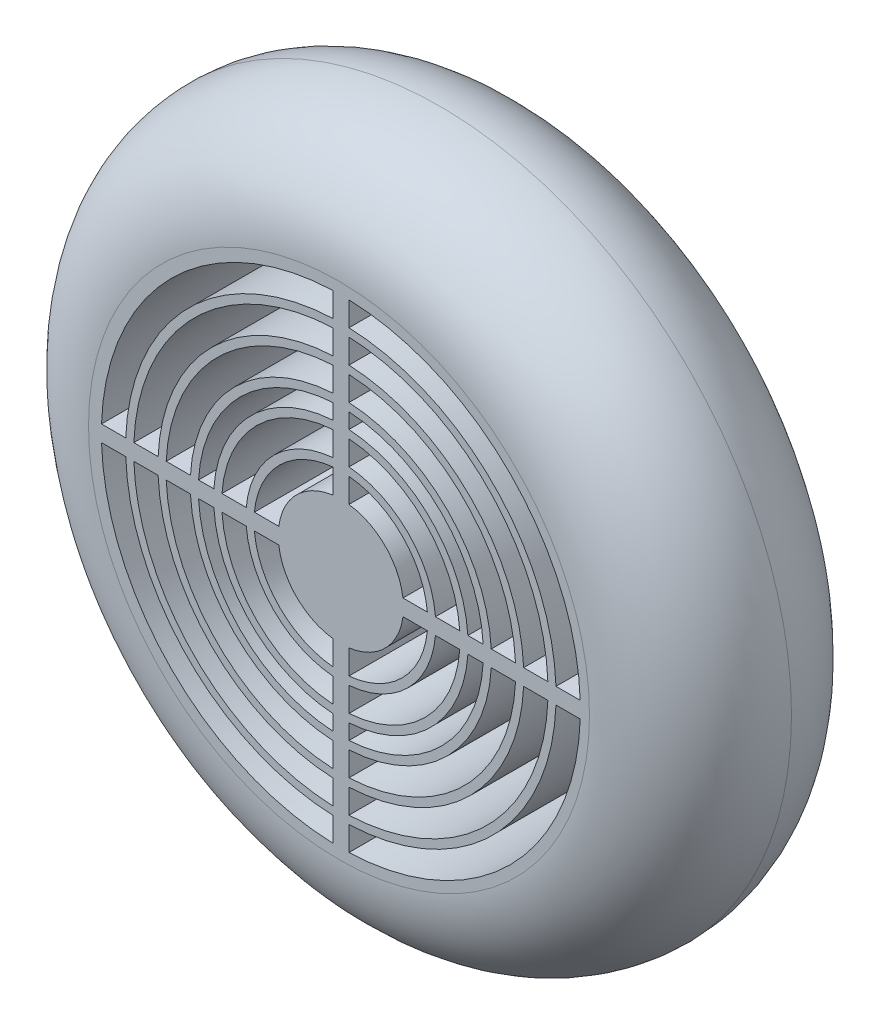
from build123d import *

# Parameters (mm, degrees)
CROQUIS1_R              = 217.5
SALIENTE_EXTRUIR1_DEPTH = 125
REDONDEO2_R             = 62.5
CORTAR_EXTRUIR4_DEPTH   = 115


with BuildPart() as part:
    # Croquis1 → Saliente-Extruir1 (new body)
    with BuildSketch(Plane.XY):
        with Locations((-1.153997035, 0)):
            Circle(CROQUIS1_R)
    extrude(amount=SALIENTE_EXTRUIR1_DEPTH)

    # Redondeo2
    redondeo2_edges = [part.edges().sort_by_distance(p)[0] for p in [
        (-218.653997035, 0, 0),
        (-218.653997035, 0, 125),
    ]]
    fillet(redondeo2_edges, radius=REDONDEO2_R - 0.0001)  # a hair under: the kernel refuses the full size

    # Croquis6 → Cortar-Extruir4 (cut)
    with BuildSketch(Plane.XY.offset(125)):
        with BuildLine():
            ThreePointArc((148.115736426, 5), (104.793299826, 104.793299826), (5, 148.115736426))
            Line((5, 148.115736426), (5, 133.106229009))
            ThreePointArc((5, 133.106229009), (94.186698108, 94.186698108), (133.106229009, 5))
            Line((133.106229009, 5), (148.115736426, 5))
        make_face()
        with BuildLine():
            ThreePointArc((5, -148.115736426), (104.793299826, -104.793299826), (148.115736426, -5))
            Line((148.115736426, -5), (133.106229009, -5))
            ThreePointArc((133.106229009, -5), (94.186698108, -94.186698108), (5, -133.106229009))
            Line((5, -133.106229009), (5, -148.115736426))
        make_face()
        with BuildLine():
            Line((-133.106229009, -5), (-148.115736426, -5))
            ThreePointArc((-148.115736426, -5), (-104.793299826, -104.793299826), (-5, -148.115736426))
            Line((-5, -148.115736426), (-5, -133.106229009))
            ThreePointArc((-5, -133.106229009), (-94.186698108, -94.186698108), (-133.106229009, -5))
        make_face()
        with BuildLine():
            Line((-5, 133.106229009), (-5, 148.115736426))
            ThreePointArc((-5, 148.115736426), (-104.793299826, 104.793299826), (-148.115736426, 5))
            Line((-148.115736426, 5), (-133.106229009, 5))
            ThreePointArc((-133.106229009, 5), (-94.186698108, 94.186698108), (-5, 133.106229009))
        make_face()
        with BuildLine():
            Line((-5, 113.089628024), (-5, 128.102564933))
            ThreePointArc((-5, 128.102564933), (-90.651164202, 90.651164202), (-128.102564933, 5))
            Line((-128.102564933, 5), (-113.089628024, 5))
            ThreePointArc((-113.089628024, 5), (-80.044562485, 80.044562485), (-5, 113.089628024))
        make_face()
        with BuildLine():
            Line((-113.089628024, -5), (-128.102564933, -5))
            ThreePointArc((-128.102564933, -5), (-90.651164202, -90.651164202), (-5, -128.102564933))
            Line((-5, -128.102564933), (-5, -113.089628024))
            ThreePointArc((-5, -113.089628024), (-80.044562485, -80.044562485), (-113.089628024, -5))
        make_face()
        with BuildLine():
            Line((-5, 93.065889198), (-5, 108.08451743))
            ThreePointArc((-5, 108.08451743), (-76.509028579, 76.509028579), (-108.08451743, 5))
            Line((-108.08451743, 5), (-93.065889198, 5))
            ThreePointArc((-93.065889198, 5), (-65.902426861, 65.902426861), (-5, 93.065889198))
        make_face()
        with BuildLine():
            Line((-93.065889198, -5), (-108.08451743, -5))
            ThreePointArc((-108.08451743, -5), (-76.509028579, -76.509028579), (-5, -108.08451743))
            Line((-5, -108.08451743), (-5, -93.065889198))
            ThreePointArc((-5, -93.065889198), (-65.902426861, -65.902426861), (-93.065889198, -5))
        make_face()
        with BuildLine():
            Line((-58.540309792, -5), (-73.58377108, -5))
            ThreePointArc((-73.58377108, -5), (-52.151564532, -52.151564532), (-5, -73.58377108))
            Line((-5, -73.58377108), (-5, -58.540309792))
            ThreePointArc((-5, -58.540309792), (-41.544962815, -41.544962815), (-58.540309792, -5))
        make_face()
        with BuildLine():
            Line((-5, 58.540309792), (-5, 73.58377108))
            ThreePointArc((-5, 73.58377108), (-52.151564532, 52.151564532), (-73.58377108, 5))
            Line((-73.58377108, 5), (-58.540309792, 5))
            ThreePointArc((-58.540309792, 5), (-41.544962815, 41.544962815), (-5, 58.540309792))
        make_face()
        with BuildLine():
            Line((-5, 78.594566383), (-5, 88.058268628))
            ThreePointArc((-5, 88.058268628), (-62.366892955, 62.366892955), (-88.058268628, 5))
            Line((-88.058268628, 5), (-78.594566383, 5))
            ThreePointArc((-78.594566383, 5), (-55.687098438, 55.687098438), (-5, 78.594566383))
        make_face()
        with BuildLine():
            Line((-78.594566383, -5), (-88.058268628, -5))
            ThreePointArc((-88.058268628, -5), (-62.366892955, -62.366892955), (-5, -88.058268628))
            Line((-5, -88.058268628), (-5, -78.594566383))
            ThreePointArc((-5, -78.594566383), (-55.687098438, -55.687098438), (-78.594566383, -5))
        make_face()
        with BuildLine():
            Line((-38.429544313, -5), (-53.520401455, -5))
            ThreePointArc((-53.520401455, -5), (-38.009428909, -38.009428909), (-5, -53.520401455))
            Line((-5, -53.520401455), (-5, -38.429544313))
            ThreePointArc((-5, -38.429544313), (-27.402827191, -27.402827191), (-38.429544313, -5))
        make_face()
        with BuildLine():
            Line((-5, 38.429544313), (-5, 53.520401455))
            ThreePointArc((-5, 53.520401455), (-38.009428909, 38.009428909), (-53.520401455, 5))
            Line((-53.520401455, 5), (-38.429544313, 5))
            ThreePointArc((-38.429544313, 5), (-27.402827191, 27.402827191), (-5, 38.429544313))
        make_face()
        with BuildLine():
            ThreePointArc((5, -53.520401455), (38.009428909, -38.009428909), (53.520401455, -5))
            Line((53.520401455, -5), (38.429544313, -5))
            ThreePointArc((38.429544313, -5), (27.402827191, -27.402827191), (5, -38.429544313))
            Line((5, -38.429544313), (5, -53.520401455))
        make_face()
        with BuildLine():
            ThreePointArc((53.520401455, 5), (38.009428909, 38.009428909), (5, 53.520401455))
            Line((5, 53.520401455), (5, 38.429544313))
            ThreePointArc((5, 38.429544313), (27.402827191, 27.402827191), (38.429544313, 5))
            Line((38.429544313, 5), (53.520401455, 5))
        make_face()
        with BuildLine():
            ThreePointArc((73.58377108, 5), (52.151564532, 52.151564532), (5, 73.58377108))
            Line((5, 73.58377108), (5, 58.540309792))
            ThreePointArc((5, 58.540309792), (41.544962815, 41.544962815), (58.540309792, 5))
            Line((58.540309792, 5), (73.58377108, 5))
        make_face()
        with BuildLine():
            ThreePointArc((88.058268628, 5), (62.366892955, 62.366892955), (5, 88.058268628))
            Line((5, 88.058268628), (5, 78.594566383))
            ThreePointArc((5, 78.594566383), (55.687098438, 55.687098438), (78.594566383, 5))
            Line((78.594566383, 5), (88.058268628, 5))
        make_face()
        with BuildLine():
            ThreePointArc((108.08451743, 5), (76.509028579, 76.509028579), (5, 108.08451743))
            Line((5, 108.08451743), (5, 93.065889198))
            ThreePointArc((5, 93.065889198), (65.902426861, 65.902426861), (93.065889198, 5))
            Line((93.065889198, 5), (108.08451743, 5))
        make_face()
        with BuildLine():
            ThreePointArc((128.102564933, 5), (90.651164202, 90.651164202), (5, 128.102564933))
            Line((5, 128.102564933), (5, 113.089628024))
            ThreePointArc((5, 113.089628024), (80.044562485, 80.044562485), (113.089628024, 5))
            Line((113.089628024, 5), (128.102564933, 5))
        make_face()
        with BuildLine():
            ThreePointArc((5, -128.102564933), (90.651164202, -90.651164202), (128.102564933, -5))
            Line((128.102564933, -5), (113.089628024, -5))
            ThreePointArc((113.089628024, -5), (80.044562485, -80.044562485), (5, -113.089628024))
            Line((5, -113.089628024), (5, -128.102564933))
        make_face()
        with BuildLine():
            ThreePointArc((5, -108.08451743), (76.509028579, -76.509028579), (108.08451743, -5))
            Line((108.08451743, -5), (93.065889198, -5))
            ThreePointArc((93.065889198, -5), (65.902426861, -65.902426861), (5, -93.065889198))
            Line((5, -93.065889198), (5, -108.08451743))
        make_face()
        with BuildLine():
            ThreePointArc((5, -88.058268628), (62.366892955, -62.366892955), (88.058268628, -5))
            Line((88.058268628, -5), (78.594566383, -5))
            ThreePointArc((78.594566383, -5), (55.687098438, -55.687098438), (5, -78.594566383))
            Line((5, -78.594566383), (5, -88.058268628))
        make_face()
        with BuildLine():
            ThreePointArc((5, -73.58377108), (52.151564532, -52.151564532), (73.58377108, -5))
            Line((73.58377108, -5), (58.540309792, -5))
            ThreePointArc((58.540309792, -5), (41.544962815, -41.544962815), (5, -58.540309792))
            Line((5, -58.540309792), (5, -73.58377108))
        make_face()
    extrude(amount=-CORTAR_EXTRUIR4_DEPTH, mode=Mode.SUBTRACT)


solid = part.part
